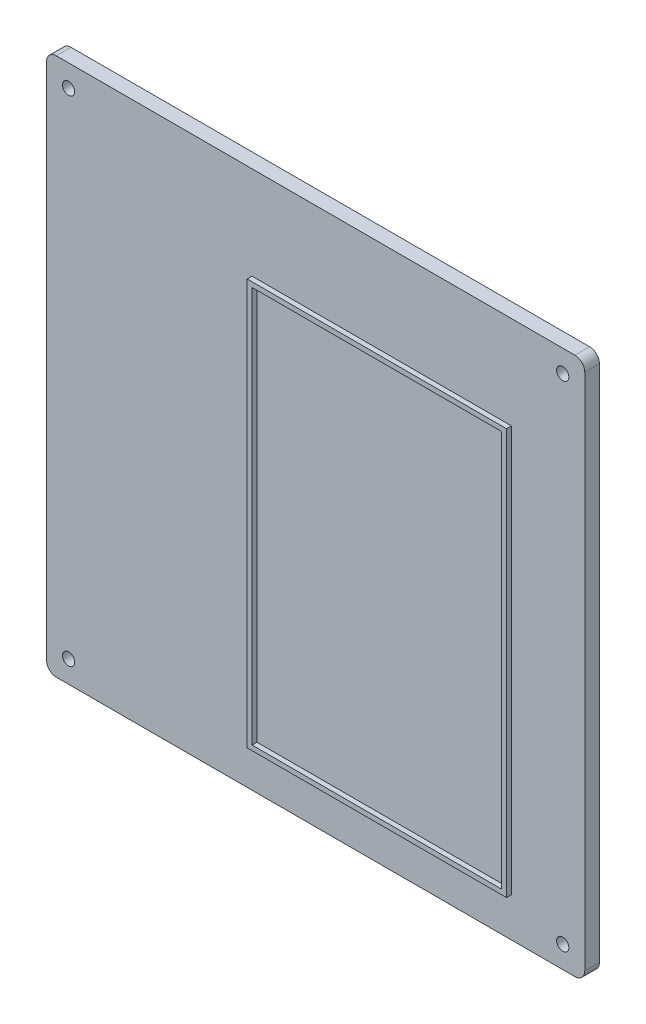
from build123d import *

# Parameters (mm, degrees)
ESQUISSE1_W        = 220
ESQUISSE1_H        = 220
ESQUISSE1_R        = 2.5
BOSS_EXTRU_1_DEPTH = 6
CONG_1_R           = 4
ESQUISSE2_W        = 106
ESQUISSE2_H        = 166
ESQUISSE2_W_2      = 102
ESQUISSE2_H_2      = 162
BOSS_EXTRU_2_DEPTH = 2


with BuildPart() as part:
    # Esquisse1 → Boss.-Extru.1 (new body)
    with BuildSketch(Plane.XY):
        with Locations((-28.150579015, -3.53164557)):
            Rectangle(ESQUISSE1_W, ESQUISSE1_H)
        with Locations((-129.150579015, 97.46835443)):
            Circle(ESQUISSE1_R, mode=Mode.SUBTRACT)
        with Locations((72.849420985, 97.46835443)):
            Circle(ESQUISSE1_R, mode=Mode.SUBTRACT)
        with Locations((72.849420985, -104.53164557)):
            Circle(ESQUISSE1_R, mode=Mode.SUBTRACT)
        with Locations((-129.150579015, -104.53164557)):
            Circle(ESQUISSE1_R, mode=Mode.SUBTRACT)
    extrude(amount=BOSS_EXTRU_1_DEPTH)

    # Congé1
    cong_1_edges = [part.edges().sort_by_distance(p)[0] for p in [
        (-138.150579015, -113.53164557, 3),
        (81.849420985, -113.53164557, 3),
        (-138.150579015, 106.46835443, 3),
        (81.849420985, 106.46835443, 3),
    ]]
    fillet(cong_1_edges, radius=CONG_1_R)

    # Esquisse2 → Boss.-Extru.2 (add)
    with BuildSketch(Plane.XY.offset(6)):
        with Locations((-1.150579015, -14.53164557)):
            Rectangle(ESQUISSE2_W, ESQUISSE2_H)
        with Locations((-1.150579015, -14.53164557)):
            Rectangle(ESQUISSE2_W_2, ESQUISSE2_H_2, mode=Mode.SUBTRACT)
    extrude(amount=BOSS_EXTRU_2_DEPTH)


solid = part.part
